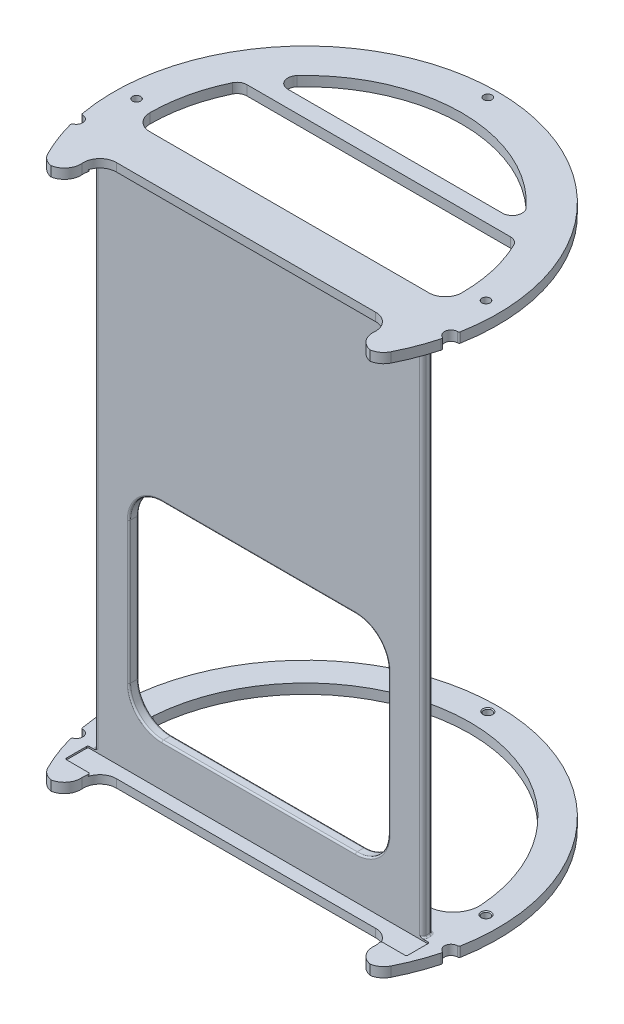
from build123d import *

# Parameters (mm, degrees)
SKETCH_2_R                   = 58.5
EXTRUDE_1_DEPTH              = 3
CUT_EXTRUDE_2_DEPTH          = 83.78586835927977
CUT_EXTRUDE_3_DEPTH          = 83.78586835927977
SKETCH_5_W                   = 107.18176753421893
SKETCH_5_H                   = 58.87645448827665
CUT_EXTRUDE_8_DEPTH          = 83.78586835927977
FILLET_2_R                   = 5
CUT_EXTRUDE_9_DEPTH          = 83.78586835927977
FILLET_4_R                   = 5
EXTRUDE_2_DEPTH              = 3
FILLET_5_R                   = 3
FILLET_7_R                   = 5
CUT_EXTRUDE_10_DEPTH         = 0.5
FILLET_8_R                   = 0.5
SKETCH_10_W                  = 80.28436653616674
SKETCH_10_H                  = 5.014377170850061
EXTRUDE_3_DEPTH              = 3
SKETCH_11_R                  = 2.0000000000000027
CUT_EXTRUDE_11_DEPTH         = 10
FILLET_9_R                   = 0.5
HOLE_WIZARD_M3_1_D           = 2.5
HOLE_WIZARD_M3_1_DEPTH       = 3.9
HOLE_WIZARD_M3_1_CSINK_D     = 3.05
HOLE_WIZARD_M3_1_CSINK_ANGLE = 90
HOLE_WIZARD_M3_1_TIP         = 0.7510757737844503
EXTRUDE_4_DEPTH              = 165
EXTRUDE_6_DEPTH              = 0.5
EXTRUDE_7_DEPTH              = 0.5
FILLET_13_R                  = 0.5
CUT_EXTRUDE_13_DEPTH         = 83.00000000000004
FILLET_14_R                  = 10
FILLET_15_R                  = 0.5
CUT_EXTRUDE_14_DEPTH         = 83.00000000000004
FILLET_16_R                  = 8


with BuildPart() as part:
    # 草图2 → 凸台-拉伸1 (new body)
    with BuildSketch(Plane(origin=(0, 0, 0), x_dir=(1, 0, 0), z_dir=(0, 1, 0))):
        with Locations(Location((0, 0, 0), (0, 0, 270))):
            Circle(SKETCH_2_R)
    extrude(amount=EXTRUDE_1_DEPTH)

    # 草图3 → 切除-拉伸2 (cut, through all)
    with BuildSketch(Plane.XZ):
        with BuildLine():
            Line((-47.236109069227965, 5), (47.236109069227965, 5))
            ThreePointArc((47.236109069227965, 5), (-8.73e-15, -47.50000000000001), (-47.236109069227965, 5))
        make_face()
    extrude(amount=-CUT_EXTRUDE_2_DEPTH, mode=Mode.SUBTRACT)

    # 草图4 → 切除-拉伸3 (cut, through all)
    with BuildSketch(Plane(origin=(0, 0, 0), x_dir=(-1, 0, 0), z_dir=(0, -1, 0))):
        with BuildLine():
            Line((-46.56392527018232, -18.21540181914406), (46.56392527018232, -18.21540181914406))
            ThreePointArc((46.56392527018232, -18.21540181914406), (-8.04e-15, -50), (-46.56392527018232, -18.21540181914406))
        make_face()
    extrude(amount=-CUT_EXTRUDE_3_DEPTH, mode=Mode.SUBTRACT)

    # 草图5 → 切除-拉伸8 (cut, through all)
    with BuildSketch(Plane(origin=(0, 0, 0), x_dir=(1, 0, 0), z_dir=(0, 1, 0))):
        with Locations((-7.11e-15, -58.50000000000001)):
            Rectangle(SKETCH_5_W, SKETCH_5_H)
    extrude(amount=CUT_EXTRUDE_8_DEPTH, mode=Mode.SUBTRACT)

    # 圆角2
    # the kernel refuses this fillet: 5 mm, written as the material it takes off along each edge
    with BuildSketch(Plane(origin=(-50.770693951202354, 10.808664320165832, 29.061772755861696), x_dir=(-0.473436338201062, 0, -0.8808280386492982), z_dir=(0, -1, 0))) as fillet_2_piece_1:
        with BuildLine():
            CenterArc((2.9899842866959925, 4.998217952911788), FILLET_2_R, 208.25758890340373, 63.272177488733405)
            Line((-1.4141559065504983, 2.6310362619064778), (0, 0))
            ThreePointArc((0, 0), (1.5617328640331962, -0.02084995093209039), (3.1234657280663445, 5e-17))
        make_face()
    extrude(amount=18.617328640331664, mode=Mode.SUBTRACT)
    with BuildSketch(Plane(origin=(50.77069395120236, 10.80866432016579, 29.061772755861686), x_dir=(0.47343633820105957, 0, -0.8808280386492995), z_dir=(0, -1, 0))) as fillet_2_piece_2:
        with BuildLine():
            CenterArc((2.989984286695978, -4.998217952911788), FILLET_2_R, 88.47023360786304, 63.272177488733234)
            Line((-1.414155906550513, -2.6310362619064778), (0, 0))
            ThreePointArc((0, 0), (1.5617328640331578, 0.0208499509320911), (3.1234657280663156, -1.1e-16))
        make_face()
    extrude(amount=18.61732864033158, mode=Mode.SUBTRACT)
    with BuildSketch(Plane(origin=(-40.68677136719815, 24.92648759771064, 29.061772755861682), x_dir=(-1, 0, 0), z_dir=(0, -1, 0))) as fillet_2_piece_3:
        with BuildLine():
            CenterArc((8.77059503908427, 5), FILLET_2_R, 154.0563627344572, 115.9436372655428)
            ThreePointArc((4.274470820331324, 7.18743388689651), (2.287760136208945, 3.5041977131728466), (0, 0))
            Line((0, 0), (8.77059503908427, 0))
        make_face()
    extrude(amount=46.85297519542128, mode=Mode.SUBTRACT)
    with BuildSketch(Plane(origin=(40.686771367198155, 24.92648759771064, 29.061772755861682), x_dir=(1, 0, 0), z_dir=(0, -1, 0))) as fillet_2_piece_4:
        with BuildLine():
            CenterArc((8.77059503908427, -5), FILLET_2_R, 90, 115.94363726554272)
            ThreePointArc((4.274470820331317, -7.187433886896507), (2.287760136208938, -3.5041977131728466), (0, 0))
            Line((0, 0), (8.77059503908427, 0))
        make_face()
    extrude(amount=46.85297519542128, mode=Mode.SUBTRACT)

    # 草图6 → 切除-拉伸9 (cut, through all)
    with BuildSketch(Plane.XZ):
        with BuildLine():
            Line((49, 14.340000000000005), (-49, 14.340000000000003))
            ThreePointArc((-49, 14.340000000000003), (-49.707106781186546, 14.047106781186551), (-50, 13.340000000000005))
            Line((-50, 13.340000000000005), (-50, 12.340000000000003))
            ThreePointArc((-50, 12.340000000000003), (-49.707106781186546, 11.632893218813456), (-49, 11.340000000000005))
            Line((-49, 11.340000000000005), (49, 11.340000000000005))
            ThreePointArc((49, 11.340000000000005), (49.707106781186546, 11.632893218813457), (50, 12.340000000000003))
            Line((50, 12.340000000000003), (50, 13.340000000000005))
            ThreePointArc((50, 13.340000000000005), (49.707106781186546, 14.047106781186553), (49, 14.340000000000005))
        make_face()
    extrude(amount=-CUT_EXTRUDE_9_DEPTH, mode=Mode.SUBTRACT)

    # 圆角4
    fillet_4_edges = [part.edges().sort_by_distance(p)[0] for p in [
        (47.236109069227965, 1.5, 5),
        (-47.236109069227965, 1.5, 5),
    ]]
    fillet(fillet_4_edges, radius=FILLET_4_R)

    # 草图7 → 凸台-拉伸2 (add)
    with BuildSketch(Plane.XZ):
        Polygon((-42.62484550097247, -22.205601330643354), (42.6248455009725, -22.205601330643354), (42.6248455009725, -27.205601330643354), (-42.62484550097246, -27.205601330643354), align=None)
    extrude(amount=-EXTRUDE_2_DEPTH)

    # 圆角5
    fillet_5_edges = [part.edges().sort_by_distance(p)[0] for p in [
        (-38.93719630684902, 1.5, -27.205601330643354),
        (38.93719630684902, 1.5, -27.205601330643354),
        (41.990013926462694, 1.5, -22.205601330643354),
        (-41.99001392646268, 1.5, -22.205601330643354),
    ]]
    fillet(fillet_5_edges, radius=FILLET_5_R)

    # 圆角7
    fillet_7_edges = [part.edges().sort_by_distance(p)[0] for p in [
        (46.563925270182324, 1.5, 18.215401819144063),
        (-46.56392527018231, 1.5, 18.21540181914406),
    ]]
    fillet(fillet_7_edges, radius=FILLET_7_R)

    # 草图8 → 切除-拉伸10 (cut)
    with BuildSketch(Plane.XZ):
        Polygon((52.00000000000001, 21.34000000000001), (-52.00000000000001, 21.339999999999996), (-52.00000000000001, 13.787312720149759), (52.00000000000001, 13.787312720149759), align=None)
    extrude(amount=-CUT_EXTRUDE_10_DEPTH, mode=Mode.SUBTRACT)

    # 圆角8
    fillet_8_edges = [part.edges().sort_by_distance(p)[0] for p in [
        (-44.128209459054425, 0.24999999999999992, 21.339999999999996),
        (52.00000000000001, 0.25, 13.787312720149759),
        (44.12820945905443, 0.24999999999999992, 21.34000000000001),
        (-52.00000000000001, 0.25, 21.339999999999996),
        (52.00000000000001, 0.25, 21.34000000000001),
        (-52.00000000000001, 0.25, 13.787312720149759),
    ]]
    fillet(fillet_8_edges, radius=FILLET_8_R)

    # 草图10 → 凸台-拉伸3 (add)
    with BuildSketch(Plane.XZ):
        with Locations((0, -24.712789916068385)):
            Rectangle(SKETCH_10_W, SKETCH_10_H)
    extrude(amount=-EXTRUDE_3_DEPTH)

    # 草图11 → 切除-拉伸11 (cut)
    with BuildSketch(Plane(origin=(0, 3, 0), x_dir=(1, 0, 0), z_dir=(0, 1, 0))):
        with Locations((-57.07349998028858, -12.840000000000003)):
            Circle(SKETCH_11_R)
        with Locations((57.07349998028858, -12.840000000000003)):
            Circle(SKETCH_11_R)
    extrude(amount=-CUT_EXTRUDE_11_DEPTH, mode=Mode.SUBTRACT)

    # 圆角9
    fillet_9_edges = [part.edges().sort_by_distance(p)[0] for p in [
        (-57.47905582712142, 1.5, 10.881550497179127),
        (-56.60123538923157, 1.5, 14.78344183242859),
        (56.60123538923157, 1.5, 14.783441832428592),
        (57.47905582712142, 1.5, 10.881550497179129),
    ]]
    fillet(fillet_9_edges, radius=FILLET_9_R)

    # M3 螺纹孔1
    with Locations(Plane.XZ):
        with Locations((53.213363577, -1.668639438), (-0.086594156, -55.526064592), (-53.213363577, -1.668639438)):
            CounterSinkHole(HOLE_WIZARD_M3_1_D / 2, HOLE_WIZARD_M3_1_CSINK_D / 2, depth=HOLE_WIZARD_M3_1_DEPTH, counter_sink_angle=HOLE_WIZARD_M3_1_CSINK_ANGLE)
            with Locations((0, 0, -(HOLE_WIZARD_M3_1_DEPTH + HOLE_WIZARD_M3_1_TIP / 2))):  # 118° drill point
                Cone(0, HOLE_WIZARD_M3_1_D / 2, HOLE_WIZARD_M3_1_TIP, mode=Mode.SUBTRACT)


with BuildPart() as body_2:
    # 草图16 → 凸台-拉伸4 (new body)
    with BuildSketch(Plane(origin=(0, 3, 0), x_dir=(1, 0, 0), z_dir=(0, 1, 0))):
        with BuildLine():
            Line((50, -12.340000000000003), (50, -13.340000000000005))
            ThreePointArc((50, -13.340000000000005), (49.707106781186546, -14.047106781186553), (49, -14.340000000000005))
            Line((49, -14.340000000000005), (-49, -14.340000000000003))
            ThreePointArc((-49, -14.340000000000003), (-49.707106781186546, -14.047106781186553), (-50, -13.340000000000005))
            Line((-50, -13.340000000000005), (-50, -12.340000000000003))
            ThreePointArc((-50, -12.340000000000003), (-49.707106781186546, -11.632893218813456), (-49, -11.340000000000003))
            Line((-49, -11.340000000000003), (49, -11.340000000000005))
            ThreePointArc((49, -11.340000000000005), (49.707106781186546, -11.632893218813456), (50, -12.340000000000003))
        make_face()
    extrude(amount=-EXTRUDE_4_DEPTH)


with BuildPart() as body_3:
    # 镜向9: mirrored copy
    add(part.part.mirror(Plane.ZX.offset(-79.5)))


with BuildPart() as body_2_1:
    add(body_2.part)

    # Combine 1: union part, body 3
    add(part.part)
    add(body_3.part)

    # 草图20 → 凸台-拉伸6 (add)
    with BuildSketch(Plane(origin=(0, -159.5, 0), x_dir=(1, 0, 0), z_dir=(0, 1, 0))):
        with BuildLine():
            Line((-49, -14.340000000000003), (-52.00000000000001, -14.340000000000005))
            Line((-52.00000000000001, -14.340000000000005), (-52.00000000000001, -14.287312720149759))
            ThreePointArc((-52.00000000000001, -14.287312720149759), (-51.853553390593284, -13.933759329556485), (-51.50000000000001, -13.787312720149759))
            Line((-51.50000000000001, -13.787312720149759), (-49.89437762180873, -13.787312720149759))
            ThreePointArc((-49.89437762180873, -13.787312720149759), (-49.52568397343378, -14.190679939856873), (-49, -14.340000000000003))
        make_face()
        with BuildLine():
            Line((49, -14.340000000000005), (52.00000000000001, -14.340000000000005))
            Line((52.00000000000001, -14.340000000000005), (52.00000000000001, -14.287312720149759))
            ThreePointArc((52.00000000000001, -14.287312720149759), (51.853553390593284, -13.933759329556485), (51.50000000000001, -13.787312720149759))
            Line((51.50000000000001, -13.787312720149759), (49.89437762180873, -13.787312720149759))
            ThreePointArc((49.89437762180873, -13.787312720149759), (49.52568397343378, -14.190679939856867), (49, -14.340000000000005))
        make_face()
    extrude(amount=EXTRUDE_6_DEPTH)

    # 草图21 → 凸台-拉伸7 (add)
    with BuildSketch(Plane.XZ.offset(-0.5)):
        with BuildLine():
            Line((49, 14.340000000000005), (52.00000000000001, 14.340000000000005))
            Line((52.00000000000001, 14.340000000000005), (52.00000000000001, 14.287312720149759))
            ThreePointArc((52.00000000000001, 14.287312720149759), (51.853553390593284, 13.933759329556485), (51.50000000000001, 13.787312720149759))
            Line((51.50000000000001, 13.787312720149759), (49.89437762180873, 13.787312720149759))
            ThreePointArc((49.89437762180873, 13.787312720149759), (49.52568397343378, 14.190679939856873), (49, 14.340000000000005))
        make_face()
        with BuildLine():
            Line((-49, 14.340000000000003), (-52.00000000000001, 14.340000000000005))
            Line((-52.00000000000001, 14.340000000000005), (-52.00000000000001, 14.287312720149759))
            ThreePointArc((-52.00000000000001, 14.287312720149759), (-51.853553390593284, 13.933759329556485), (-51.50000000000001, 13.787312720149759))
            Line((-51.50000000000001, 13.787312720149759), (-49.89437762180873, 13.787312720149759))
            ThreePointArc((-49.89437762180873, 13.787312720149759), (-49.52568397343378, 14.190679939856865), (-49, 14.340000000000003))
        make_face()
    extrude(amount=EXTRUDE_7_DEPTH)

    # 圆角13
    # the kernel refuses this fillet: 0.5 mm, written as the material it adds along each edge
    with BuildSketch(Plane(origin=(-49.00000000000002, -159, 13.34000000000002), x_dir=(0.9491428341660971, 0, 0.31484580408693535), z_dir=(0.31484580408693535, 0, -0.9491428341660971))) as fillet_13_piece_1_section:
        with BuildLine():
            CenterArc((1.0000000000000069 + FILLET_13_R, -FILLET_13_R), FILLET_13_R, 90, 90)
            Line((1.0000000000000069 + FILLET_13_R, 0), (1.0000000000000069, 0))
            Line((1.0000000000000069, 0), (1.0000000000000069, -FILLET_13_R))
        make_face()
    fillet_13_piece_1 = revolve(axis=Axis((-49.00000000000002, -159, 13.34000000000002), (0, -1, 0)), revolution_arc=161.6484946187006, mode=Mode.PRIVATE)
    fillet_13_piece_1 = split(fillet_13_piece_1, bisect_by=Plane(origin=(-49.7310983062367, -158.86392441460762, 14.340000000000003), z_dir=(2e-17, 0, -1)), keep=Keep.TOP, mode=Mode.PRIVATE)
    add(fillet_13_piece_1)
    with BuildSketch(Plane(origin=(-50, -159, 13.340000000000005), x_dir=(0, 1, 0), z_dir=(0, 0, -1))) as fillet_13_piece_2:
        with BuildLine():
            CenterArc((FILLET_13_R, -FILLET_13_R), FILLET_13_R, 90, 90)
            Line((0, -FILLET_13_R), (0, 0))
            Line((0, 0), (FILLET_13_R, 0))
        make_face()
    extrude(amount=1.0000000000000018)
    with BuildSketch(Plane(origin=(-49.00000000000001, -159, 12.340000000000005), x_dir=(-1, 0, -1.78e-15), z_dir=(-1.78e-15, 0, 1))) as fillet_13_piece_3:
        with BuildLine():
            CenterArc((0.9999999999999929 + FILLET_13_R, -FILLET_13_R), FILLET_13_R, 90, 90)
            Line((0.9999999999999929 + FILLET_13_R, 0), (0.9999999999999929, 0))
            Line((0.9999999999999929, 0), (0.9999999999999929, -FILLET_13_R))
        make_face()
    revolve(axis=Axis((-49.00000000000001, -159, 12.340000000000005), (0, -1, 0)), revolution_arc=90.0000000000003)
    with BuildSketch(Plane(origin=(-49, -159, 11.340000000000005), x_dir=(0, 1, -3.55e-15), z_dir=(1, 0, 0))) as fillet_13_piece_4:
        with BuildLine():
            CenterArc((FILLET_13_R, -FILLET_13_R), FILLET_13_R, 90.0000000000002, 89.9999999999998)
            Line((1.78e-15, -FILLET_13_R), (0, 0))
            Line((0, 0), (FILLET_13_R, 0))
        make_face()
    extrude(amount=98)
    with BuildSketch(Plane(origin=(49, -159, 12.340000000000007), x_dir=(0, 0, -1), z_dir=(-1, 0, 0))) as fillet_13_piece_5:
        with BuildLine():
            CenterArc((1 + FILLET_13_R, -FILLET_13_R), FILLET_13_R, 89.9999999999998, 90.00000000000023)
            Line((1 + FILLET_13_R, 0), (1, 0))
            Line((1, 0), (0.9999999999999982, -FILLET_13_R))
        make_face()
    revolve(axis=Axis((49, -159, 12.340000000000007), (0, -1, 0)), revolution_arc=89.9999999999998)
    with BuildSketch(Plane(origin=(50, -159, 12.340000000000003), x_dir=(1, 0, 0), z_dir=(0, 0, 1))) as fillet_13_piece_6:
        with BuildLine():
            CenterArc((FILLET_13_R, FILLET_13_R), FILLET_13_R, 180, 90)
            Line((0, FILLET_13_R), (0, 0))
            Line((0, 0), (FILLET_13_R, 0))
        make_face()
    extrude(amount=1.0000000000000018)
    with BuildSketch(Plane(origin=(49, -159, 13.340000000000005), x_dir=(1, 0, 0), z_dir=(0, 0, -1))) as fillet_13_piece_7_section:
        with BuildLine():
            CenterArc((1 + FILLET_13_R, -FILLET_13_R), FILLET_13_R, 90, 90)
            Line((1 + FILLET_13_R, 0), (1, 0))
            Line((1, 0), (1, -FILLET_13_R))
        make_face()
    fillet_13_piece_7 = revolve(axis=Axis((49, -159, 13.340000000000005), (0, -1, 0)), revolution_arc=161.64849461869767, mode=Mode.PRIVATE)
    fillet_13_piece_7 = split(fillet_13_piece_7, bisect_by=Plane(origin=(49.73109797276826, -158.8639243412678, 14.340000000000005), z_dir=(2e-17, 0, -1)), keep=Keep.TOP, mode=Mode.PRIVATE)
    add(fillet_13_piece_7)
    with BuildSketch(Plane(origin=(-52, -160.75000000000003, 14.340000000000003), x_dir=(1, 0, 0), z_dir=(0, 1, 0))) as fillet_13_piece_8:
        with BuildLine():
            CenterArc((FILLET_13_R, -FILLET_13_R), FILLET_13_R, 90, 90)
            Line((0, -FILLET_13_R), (0, 0))
            Line((0, 0), (FILLET_13_R, 0))
        make_face()
    extrude(amount=1.7500000000000284)
    with BuildSketch(Plane(origin=(52.00000000000001, -160.75, 14.340000000000005), x_dir=(-1, 0, 0), z_dir=(0, 1, 0))) as fillet_13_piece_9:
        with BuildLine():
            CenterArc((FILLET_13_R, FILLET_13_R), FILLET_13_R, 180, 90)
            Line((0, FILLET_13_R), (0, 0))
            Line((0, 0), (FILLET_13_R, 0))
        make_face()
    extrude(amount=1.75)
    with BuildSketch(Plane(origin=(52.00000000000001, 1.75, 14.340000000000005), x_dir=(-1, 0, 0), z_dir=(0, -1, 0))) as fillet_13_piece_10:
        with BuildLine():
            CenterArc((FILLET_13_R, -FILLET_13_R), FILLET_13_R, 90, 90)
            Line((0, -FILLET_13_R), (0, 0))
            Line((0, 0), (FILLET_13_R, 0))
        make_face()
    extrude(amount=1.75)
    with BuildSketch(Plane(origin=(-52, 1.7500000000000178, 14.340000000000003), x_dir=(1, 0, 0), z_dir=(0, -1, 0))) as fillet_13_piece_11:
        with BuildLine():
            CenterArc((FILLET_13_R, FILLET_13_R), FILLET_13_R, 180, 90)
            Line((0, FILLET_13_R), (0, 0))
            Line((0, 0), (FILLET_13_R, 0))
        make_face()
    extrude(amount=1.7500000000000178)
    with BuildSketch(Plane(origin=(-49, 0, 13.340000000000002), x_dir=(-1, 0, 3.55e-15), z_dir=(-3.55e-15, 0, -1))) as fillet_13_piece_12_section:
        with BuildLine():
            CenterArc((1 + FILLET_13_R, -FILLET_13_R), FILLET_13_R, 90, 90)
            Line((1 + FILLET_13_R, 0), (1, 0))
            Line((1, 0), (1, -FILLET_13_R))
        make_face()
    fillet_13_piece_12 = revolve(axis=Axis((-49, 0, 13.340000000000002), (0, 1, 0)), revolution_arc=161.64849461869704, mode=Mode.PRIVATE)
    fillet_13_piece_12 = split(fillet_13_piece_12, bisect_by=Plane(origin=(-49.7310982912707, -0.13607517080315468, 14.340000000000003), z_dir=(2e-17, 0, -1)), keep=Keep.TOP, mode=Mode.PRIVATE)
    add(fillet_13_piece_12)
    with BuildSketch(Plane(origin=(49.000000000000014, 0, 13.340000000000014), x_dir=(-0.9491428341660922, 0, 0.31484580408694973), z_dir=(-0.31484580408694973, 0, -0.9491428341660922))) as fillet_13_piece_13_section:
        with BuildLine():
            CenterArc((1.0000000000000113 + FILLET_13_R, -FILLET_13_R), FILLET_13_R, 90, 90)
            Line((1.0000000000000113 + FILLET_13_R, 0), (1.0000000000000113, 0))
            Line((1.0000000000000113, 0), (1.0000000000000107, -FILLET_13_R))
        make_face()
    fillet_13_piece_13 = revolve(axis=Axis((49.000000000000014, 0, 13.340000000000014), (0, 1, 0)), revolution_arc=161.64849461869954, mode=Mode.PRIVATE)
    fillet_13_piece_13 = split(fillet_13_piece_13, bisect_by=Plane(origin=(49.73109778395507, -0.13607601222519117, 14.340000000000005), z_dir=(2e-17, 0, -1)), keep=Keep.TOP, mode=Mode.PRIVATE)
    add(fillet_13_piece_13)
    with BuildSketch(Plane(origin=(50, 0, 12.340000000000003), x_dir=(0, -1, 0), z_dir=(0, 0, 1)), Plane(origin=(-50, 0, 13.340000000000005), x_dir=(0, -1, 0), z_dir=(0, 0, -1))) as fillet_13_piece_14:
        with BuildLine():
            CenterArc((FILLET_13_R, FILLET_13_R), FILLET_13_R, 180, 90)
            Line((0, FILLET_13_R), (0, 0))
            Line((0, 0), (FILLET_13_R, 0))
        make_face()
    extrude(amount=1.0000000000000018)
    with BuildSketch(Plane(origin=(49, 0, 12.340000000000007), x_dir=(0, 0, -1), z_dir=(-1, 0, 0))) as fillet_13_piece_15:
        with BuildLine():
            CenterArc((1 + FILLET_13_R, FILLET_13_R), FILLET_13_R, 180, 90.00000000000023)
            Line((1 + FILLET_13_R, 0), (1, 0))
            Line((1, 0), (0.9999999999999982, FILLET_13_R))
        make_face()
    revolve(axis=Axis((49, 0, 12.340000000000007), (0, -1, 0)), revolution_arc=89.9999999999998)
    with BuildSketch(Plane(origin=(-49, 0, 11.340000000000005), x_dir=(0, -1, -3.55e-15), z_dir=(1, 0, 0))) as fillet_13_piece_16:
        with BuildLine():
            CenterArc((FILLET_13_R, FILLET_13_R), FILLET_13_R, 180, 89.99999999999977)
            Line((1.78e-15, FILLET_13_R), (0, 0))
            Line((0, 0), (FILLET_13_R, 0))
        make_face()
    extrude(amount=98)
    with BuildSketch(Plane(origin=(-49.00000000000001, 0, 12.340000000000005), x_dir=(-1, 0, -1.78e-15), z_dir=(-1.78e-15, 0, 1))) as fillet_13_piece_17:
        with BuildLine():
            CenterArc((0.9999999999999929 + FILLET_13_R, FILLET_13_R), FILLET_13_R, 180, 90)
            Line((0.9999999999999929 + FILLET_13_R, 0), (0.9999999999999929, 0))
            Line((0.9999999999999929, 0), (0.9999999999999929, FILLET_13_R))
        make_face()
    revolve(axis=Axis((-49.00000000000001, 0, 12.340000000000005), (0, -1, 0)), revolution_arc=90.0000000000003)

    # 草图22 → 切除-拉伸13 (cut)
    with BuildSketch(Plane(origin=(-2e-16, 0, 11.340000000000003), x_dir=(-1, 0, -2e-17), z_dir=(2e-17, 0, -1))):
        Polygon((-39.50000000000001, -83.49999999999999), (39.49999999999999, -83.49999999999999), (39.50000000000001, -146.5), (-39.499999999999986, -146.5), align=None)
    extrude(amount=-CUT_EXTRUDE_13_DEPTH, mode=Mode.SUBTRACT)

    # 圆角14
    fillet_14_edges = [body_2_1.edges().sort_by_distance(p)[0] for p in [
        (-39.49999999999999, -83.49999999999999, 12.840000000000002),
        (-39.50000000000001, -146.5, 12.840000000000002),
        (39.499999999999986, -146.5, 12.840000000000002),
        (39.50000000000001, -83.49999999999999, 12.840000000000002),
    ]]
    fillet(fillet_14_edges, radius=FILLET_14_R)

    # 圆角15
    fillet_15_edges = [body_2_1.edges().sort_by_distance(p)[0] for p in [
        (-7.11e-15, -146.5, 14.34),
        (-7.31e-15, -146.5, 11.340000000000003),
        (39.5, -115, 14.34),
        (39.5, -115, 11.340000000000003),
        (-39.5, -115, 14.34),
        (-39.5, -114.99999999999999, 11.340000000000003),
        (3.55e-15, -83.49999999999999, 14.34),
        (6.9e-15, -83.49999999999999, 11.340000000000003),
        (36.57106781186546, -143.57106781186548, 11.340000000000003),
        (36.57106781186546, -143.57106781186548, 14.34),
        (-36.57106781186548, -143.57106781186548, 11.340000000000003),
        (-36.57106781186548, -143.57106781186548, 14.34),
        (-36.57106781186547, -86.42893218813451, 11.340000000000003),
        (-36.57106781186547, -86.42893218813451, 14.34),
        (36.571067811865476, -86.42893218813451, 11.340000000000003),
        (36.571067811865476, -86.42893218813451, 14.34),
    ]]
    fillet(fillet_15_edges, radius=FILLET_15_R)

    # 草图23 → 切除-拉伸14 (cut)
    with BuildSketch(Plane.XZ.offset(162)):
        with BuildLine():
            Line((-1.388e-14, 5), (49.749371855331, 5))
            ThreePointArc((49.749371855331, 5), (-9.18e-15, -50), (-49.749371855331, 5))
            Line((-49.749371855331, 5), (-1.388e-14, 5))
        make_face()
    extrude(amount=-CUT_EXTRUDE_14_DEPTH, mode=Mode.SUBTRACT)

    # 圆角16
    fillet_16_edges = [body_2_1.edges().sort_by_distance(p)[0] for p in [
        (-49.749371855331006, -160.5, 4.999999999999995),
        (49.74937185533099, -160.5, 5),
    ]]
    fillet(fillet_16_edges, radius=FILLET_16_R)


solid = body_2_1.part
